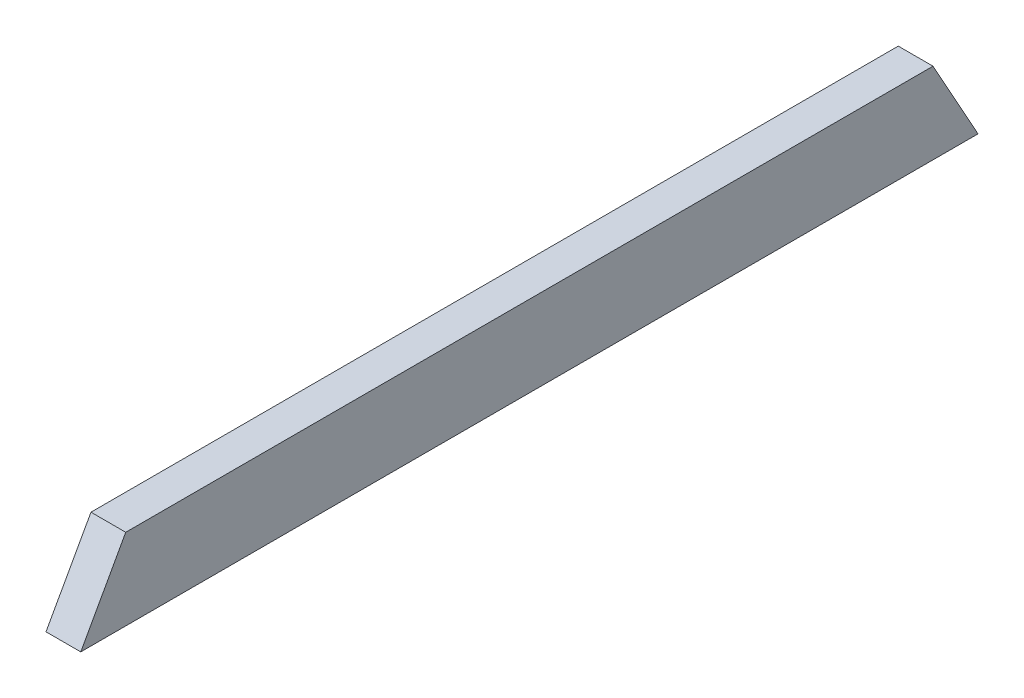
from build123d import *

# Parameters (mm, degrees)
SKETCH1_W           = 38.1
SKETCH1_H           = 88.9
BOSS_EXTRUDE1_DEPTH = 983.234
CUT_EXTRUDE1_DEPTH  = 988.979715761


with BuildPart() as part:
    # Sketch1 → Boss-Extrude1 (new body)
    with BuildSketch(Plane.XY):
        with Locations((19.05, 44.45)):
            Rectangle(SKETCH1_W, SKETCH1_H)
    extrude(amount=BOSS_EXTRUDE1_DEPTH)

    # Sketch2 → Cut-Extrude1 (cut, through all)
    with BuildSketch(Plane(origin=(38.1, 0, 0), x_dir=(0, 0, -1), z_dir=(1, 0, 0))):
        Polygon((-983.234, 0), (-933.955925326, 88.9), (-983.234, 88.9), align=None)
        Polygon((0, 0), (-49.278074674, 88.9), (0, 88.9), align=None)
    extrude(amount=-CUT_EXTRUDE1_DEPTH, mode=Mode.SUBTRACT)


solid = part.part
